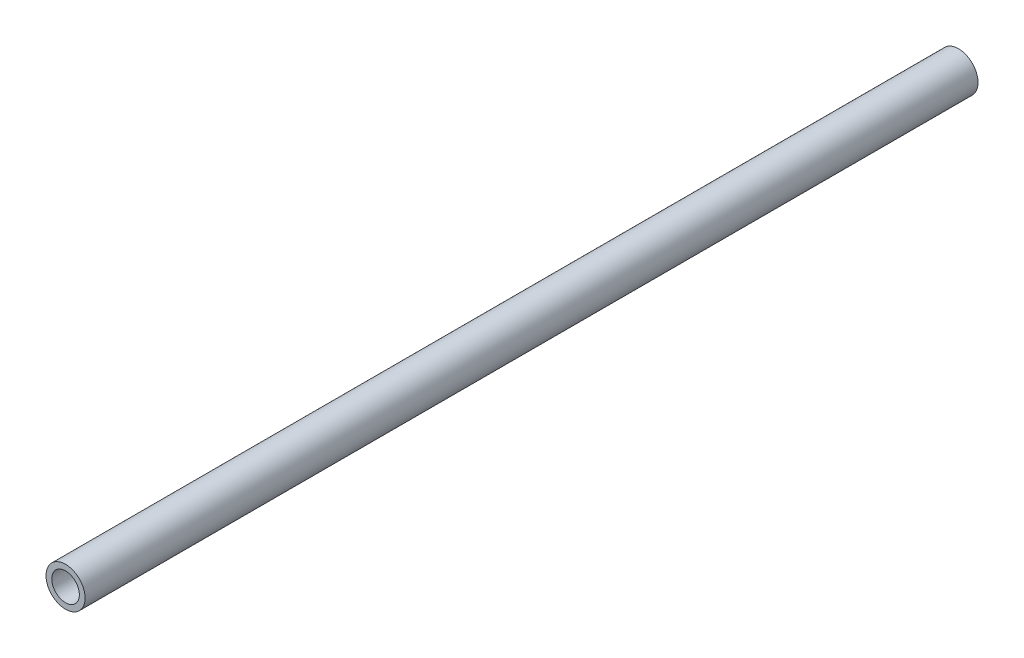
from build123d import *

# Parameters (mm, degrees)
SKETCH1_R           = 13.335
SKETCH1_R_2         = 9.4234
EXTRUDE_THIN1_DEPTH = 304.8


with BuildPart() as part:
    # Sketch1 → Extrude-Thin1 (new, symmetric)
    with BuildSketch(Plane.XY):
        Circle(SKETCH1_R)
        Circle(SKETCH1_R_2, mode=Mode.SUBTRACT)
    extrude(amount=EXTRUDE_THIN1_DEPTH, both=True)


solid = part.part
